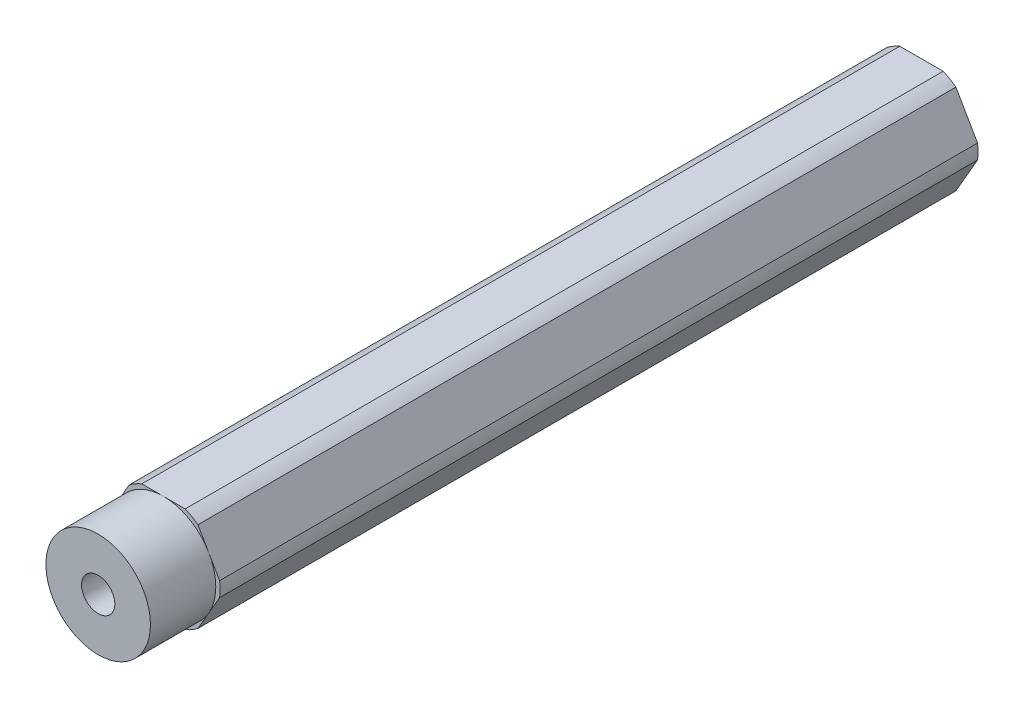
from build123d import *

# Parameters (mm, degrees)
SKETCH1_R           = 2.0193
BOSS_EXTRUDE1_DEPTH = 50.00625
SKETCH2_OUTSIDE_W   = 36.1
SKETCH2_OUTSIDE_H   = 35.05
SKETCH2_OUTSIDE_R   = 6.35
CUT_EXTRUDE2_DEPTH  = 7.9375


with BuildPart() as part:
    # Sketch1 → Boss-Extrude1 (new, symmetric)
    with BuildSketch(Plane.XY):
        with BuildLine():
            ThreePointArc((4.181770846, 5.456960429), (3.437499983, 5.953924622), (2.634980936, 6.35))
            Line((2.634980936, 6.35), (-2.634980936, 6.35))
            ThreePointArc((-2.634980936, 6.35), (-3.437499983, 5.953924622), (-4.181770846, 5.456960429))
            Line((-4.181770846, 5.456960429), (-6.816751782, 0.893039571))
            ThreePointArc((-6.816751782, 0.893039571), (-6.874999966, 0), (-6.816751782, -0.893039571))
            Line((-6.816751782, -0.893039571), (-4.181770846, -5.456960429))
            ThreePointArc((-4.181770846, -5.456960429), (-3.437499983, -5.953924622), (-2.634980936, -6.35))
            Line((-2.634980936, -6.35), (2.634980936, -6.35))
            ThreePointArc((2.634980936, -6.35), (3.437499983, -5.953924622), (4.181770846, -5.456960429))
            Line((4.181770846, -5.456960429), (6.816751782, -0.893039571))
            ThreePointArc((6.816751782, -0.893039571), (6.860422465, -0.447468582), (6.874999966, 0))
            ThreePointArc((6.874999966, 0), (6.860422465, 0.447468582), (6.816751782, 0.893039571))
            Line((6.816751782, 0.893039571), (4.181770846, 5.456960429))
        make_face()
        Circle(SKETCH1_R, mode=Mode.SUBTRACT)
    extrude(amount=BOSS_EXTRUDE1_DEPTH, both=True)

    # Sketch2 outside → Cut-Extrude2 (cut)
    with BuildSketch(Plane.XY.offset(50.00625)):
        Rectangle(SKETCH2_OUTSIDE_W, SKETCH2_OUTSIDE_H)
        Circle(SKETCH2_OUTSIDE_R, mode=Mode.SUBTRACT)
    extrude(amount=-CUT_EXTRUDE2_DEPTH, mode=Mode.SUBTRACT)


solid = part.part
